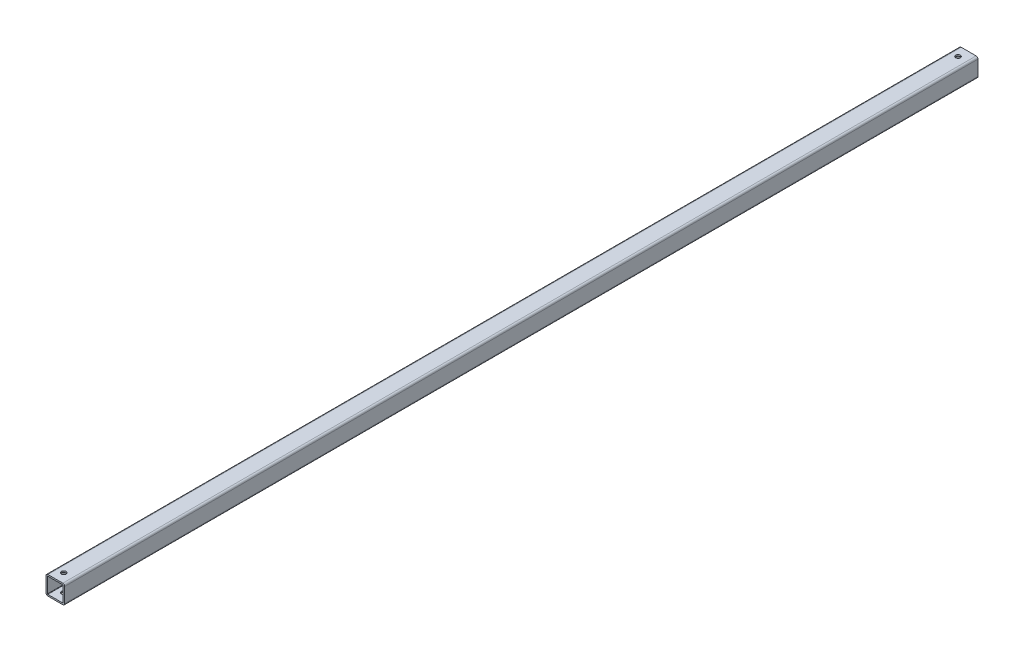
from build123d import *

# Parameters (mm, degrees)
EXTRUDE_THIN1_DEPTH             = 609.6
F_1_4_0_25_DIAMETER_HOLE1_D     = 6.35
F_1_4_0_25_DIAMETER_HOLE1_DEPTH = 27.94
F_1_4_0_25_DIAMETER_HOLE1_TIP   = 1.907732465


with BuildPart() as part:
    # Sketch1 → Extrude-Thin1 (new, symmetric)
    with BuildSketch(Plane.XY):
        with BuildLine():
            Line((-12.5, -10), (-12.5, 10))
            ThreePointArc((-12.5, 10), (-11.767766953, 11.767766953), (-10, 12.5))
            Line((-10, 12.5), (10, 12.5))
            ThreePointArc((10, 12.5), (11.767766953, 11.767766953), (12.5, 10))
            Line((12.5, 10), (12.5, -10))
            ThreePointArc((12.5, -10), (11.767766953, -11.767766953), (10, -12.5))
            Line((10, -12.5), (-10, -12.5))
            ThreePointArc((-10, -12.5), (-11.767766953, -11.767766953), (-12.5, -10))
        make_face()
        with BuildLine():
            Line((-10.5, -10), (-10.5, 10))
            ThreePointArc((-10.5, 10), (-10.353553391, 10.353553391), (-10, 10.5))
            Line((-10, 10.5), (10, 10.5))
            ThreePointArc((10, 10.5), (10.353553391, 10.353553391), (10.5, 10))
            Line((10.5, 10), (10.5, -10))
            ThreePointArc((10.5, -10), (10.353553391, -10.353553391), (10, -10.5))
            Line((10, -10.5), (-10, -10.5))
            ThreePointArc((-10, -10.5), (-10.353553391, -10.353553391), (-10.5, -10))
        make_face(mode=Mode.SUBTRACT)
    extrude(amount=EXTRUDE_THIN1_DEPTH, both=True)

    # 1/4 (0.25) Diameter Hole1
    with Locations(Plane(origin=(0, 12.5, 0), x_dir=(1, 0, 0), z_dir=(0, 1, 0))):
        with Locations((-1.399162535, 596.9), (-1.399162535, -596.9)):
            Hole(F_1_4_0_25_DIAMETER_HOLE1_D / 2, depth=F_1_4_0_25_DIAMETER_HOLE1_DEPTH)
            with Locations((0, 0, -(F_1_4_0_25_DIAMETER_HOLE1_DEPTH + F_1_4_0_25_DIAMETER_HOLE1_TIP / 2))):  # 118° drill point
                Cone(0, F_1_4_0_25_DIAMETER_HOLE1_D / 2, F_1_4_0_25_DIAMETER_HOLE1_TIP, mode=Mode.SUBTRACT)


solid = part.part
